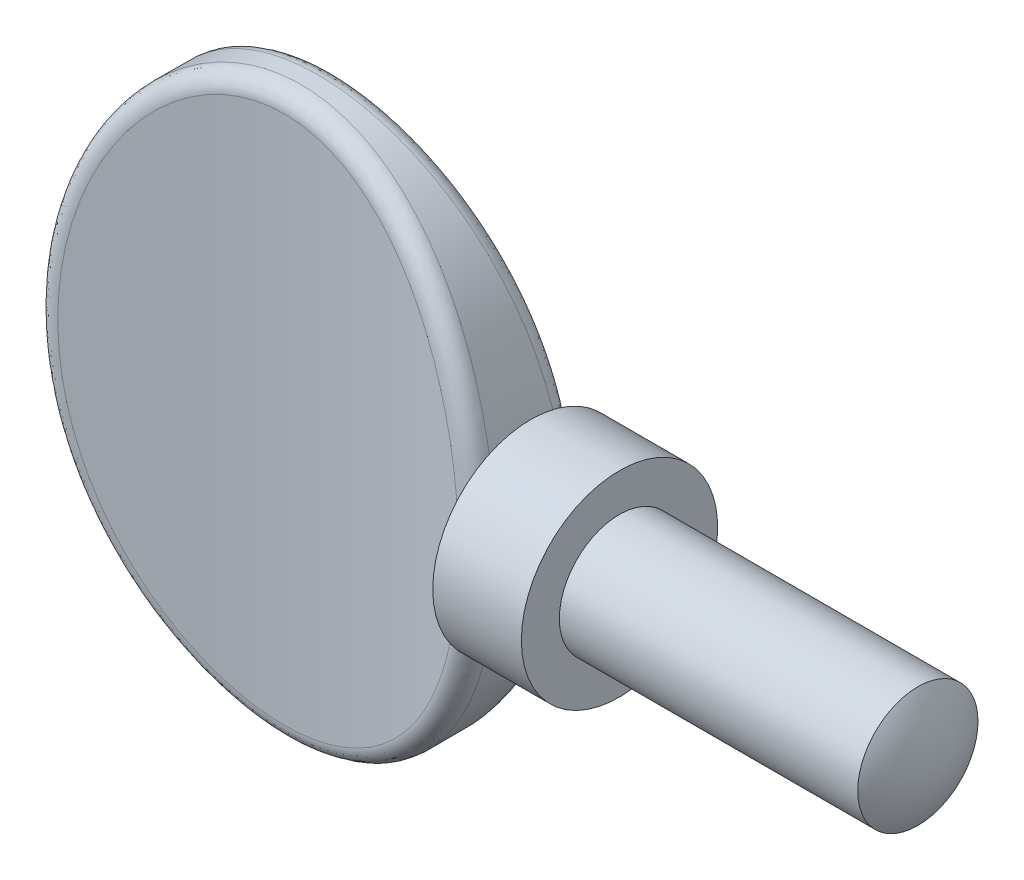
from build123d import *

# Parameters (mm, degrees)
SKETCH1_RX              = 11.303
SKETCH1_RY              = 8.889999999999999
EXTRUDE1_DEPTH          = 2.286
CUT_EXTRUDE1_DEPTH      = 15.560759080487529
CUT_EXTRUDE1_DEPTH_BACK = 15.560759080487529
SKETCH2_OUTSIDE_W       = 25.603999999999996
SKETCH2_OUTSIDE_H       = 12.396
FILLET3_R               = 0.6773333333333333


with BuildPart() as part:
    # Sketch1 → Extrude1 (new, symmetric)
    with BuildSketch(Plane.XY):
        with Locations(Location((0, 0), (0, 0, 90))):
            Ellipse(SKETCH1_RX, SKETCH1_RY)
    extrude(amount=EXTRUDE1_DEPTH, both=True)

    # Sketch2 outside → Cut-Extrude1 (cut, two sides: drawn at the far end of the back side and taken through both)
    with BuildSketch(Plane(origin=(0, 0, 0), x_dir=(1, 0, 0), z_dir=(0, 1, 0)).offset(-CUT_EXTRUDE1_DEPTH_BACK)):
        Rectangle(SKETCH2_OUTSIDE_W, SKETCH2_OUTSIDE_H)
        with BuildLine():
            Line((-8.889999999999999, 2.286), (-8.889999999999999, -2.286))
            ThreePointArc((-8.889999999999999, -2.286), (1.94e-15, -1.0159999999999982), (8.889999999999999, -2.286))
            Line((8.889999999999999, -2.286), (8.889999999999999, 2.286))
            ThreePointArc((8.889999999999999, 2.286), (1.94e-15, 1.0159999999999982), (-8.889999999999999, 2.286))
        make_face(mode=Mode.SUBTRACT)
    extrude(amount=CUT_EXTRUDE1_DEPTH + CUT_EXTRUDE1_DEPTH_BACK, mode=Mode.SUBTRACT)

    # Fillet3
    fillet3_edges = [part.edges().sort_by_distance(p)[0] for p in [
        (-6.499256061e-08, -11.302999999991183, 1.0159999999964504),
        (8.835220095e-08, -11.302999999991183, -1.0159999999964522),
    ]]
    fillet(fillet3_edges, radius=FILLET3_R)

    # Sketch3 → Revolve1 (revolve)
    with BuildSketch(Plane(origin=(0, 0, 0), x_dir=(1, 0, 0), z_dir=(0, 1, 0))):
        with BuildLine():
            Line((12.445999999999996, 3.9369999999999994), (12.445999999999996, 2.413))
            Line((12.445999999999996, 2.413), (24.41915612823658, 2.4129999999999994))
            ThreePointArc((24.41915612823658, 2.4129999999999994), (24.960344234486776, 1.2600467267050082), (25.145999999999994, 0))
            Line((25.145999999999994, 0), (7.236423048052516, 0))
            Line((7.236423048052516, 0), (7.236423048052516, 1.8516557328217895))
            ThreePointArc((7.236423048052516, 1.8516557328217895), (8.426438076724871, 2.6063068114075874), (8.889999999999999, 3.9370000000000003))
            Line((8.889999999999999, 3.9370000000000003), (12.445999999999996, 3.9369999999999994))
        make_face()
    revolve(axis=Axis((0, 0, 0), (1, 0, 0)))


solid = part.part
